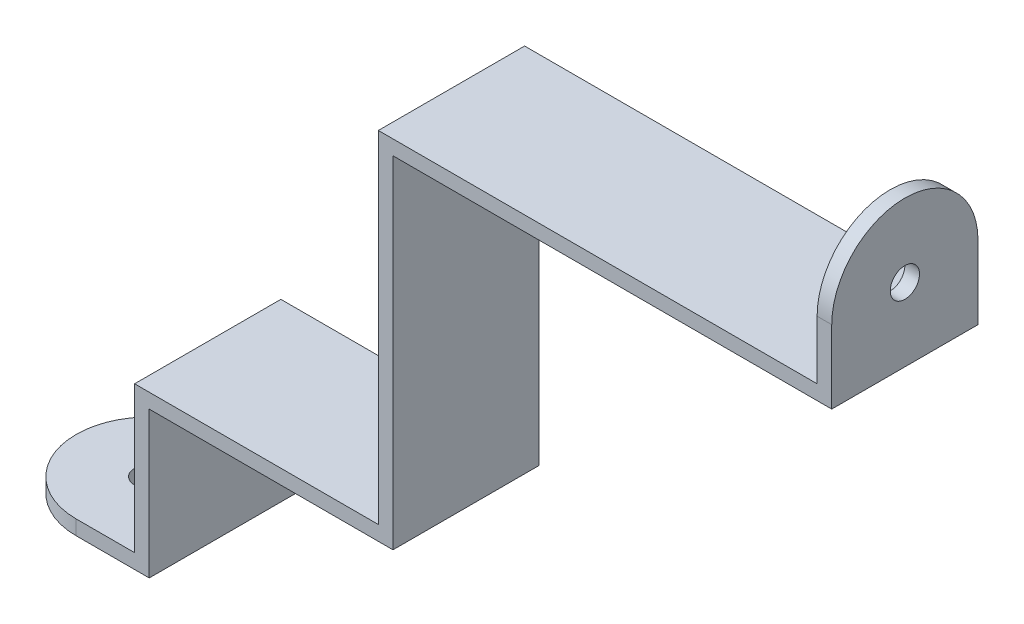
from build123d import *

# Parameters (mm, degrees)
BOSS_EXTRUDE1_DEPTH = 15
SKETCH5_R           = 1.5
CUT_EXTRUDE3_DEPTH  = 10
SKETCH6_R           = 1.5
CUT_EXTRUDE4_DEPTH  = 10


with BuildPart() as part:
    # Sketch1 → Boss-Extrude1 (new body)
    with BuildSketch(Plane.XY):
        Polygon((0, 0), (0, 35), (45, 35), (45, 50), (43.5, 50), (43.5, 36.5), (-1.5, 36.5), (-1.5, 35), (-1.5, 1.5), (-16.5, 1.5), (-26.5, 1.5), (-26.5, -13.5), (-40, -13.5), (-40, -15), (-25, -15), (-25, 0), align=None)
    extrude(amount=BOSS_EXTRUDE1_DEPTH)

    # Sketch5 → Cut-Extrude3 (cut)
    with BuildSketch(Plane.ZY.offset(-43.5)):
        with BuildLine():
            Line((15, 50), (7.5, 50))
            ThreePointArc((7.5, 50), (12.803300859, 47.803300859), (15, 42.5))
            Line((15, 42.5), (15, 50))
        make_face()
        with BuildLine():
            Line((0, 50), (0, 42.5))
            ThreePointArc((0, 42.5), (2.196699141, 47.803300859), (7.5, 50))
            Line((7.5, 50), (0, 50))
        make_face()
        with Locations((7.5, 42.5)):
            Circle(SKETCH5_R)
    extrude(amount=-CUT_EXTRUDE3_DEPTH, mode=Mode.SUBTRACT)

    # Sketch6 → Cut-Extrude4 (cut)
    with BuildSketch(Plane(origin=(0, -13.5, 0), x_dir=(1, 0, 0), z_dir=(0, 1, 0))):
        with BuildLine():
            Line((-40, 0), (-40, -7.5))
            ThreePointArc((-40, -7.5), (-37.803300859, -2.196699141), (-32.5, 0))
            Line((-32.5, 0), (-40, 0))
        make_face()
        with BuildLine():
            Line((-40, -15), (-32.5, -15))
            ThreePointArc((-32.5, -15), (-37.803300859, -12.803300859), (-40, -7.5))
            Line((-40, -7.5), (-40, -15))
        make_face()
        with Locations((-32.5, -7.5)):
            Circle(SKETCH6_R)
    extrude(amount=-CUT_EXTRUDE4_DEPTH, mode=Mode.SUBTRACT)


solid = part.part
